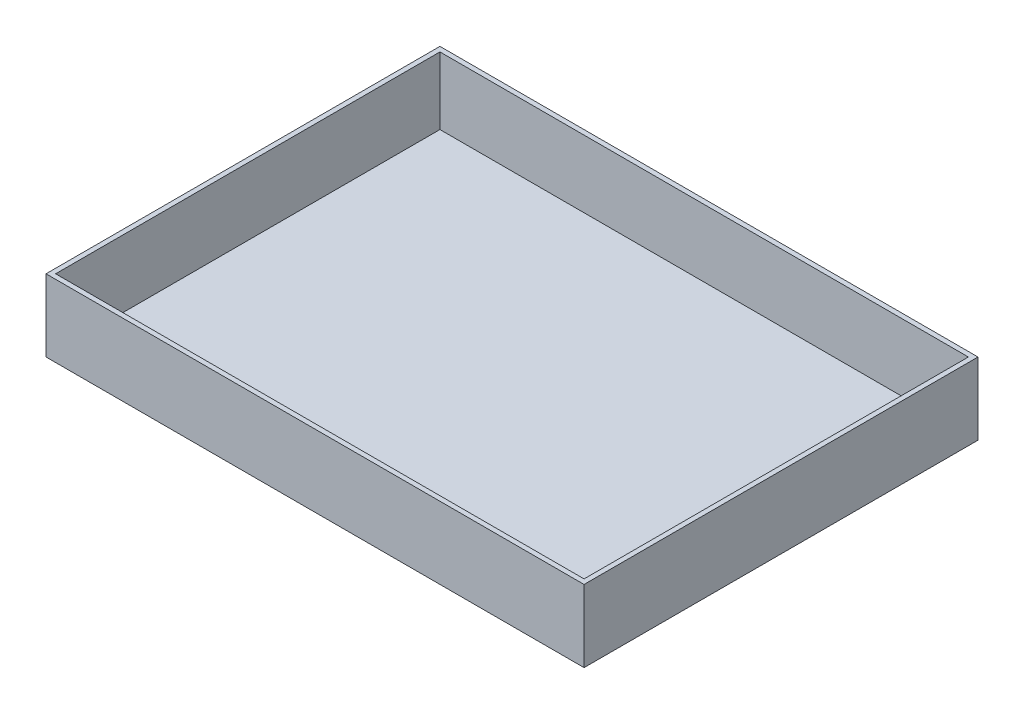
from build123d import *

# Parameters (mm, degrees)
SKETCH_1_W      = 560
SKETCH_1_H      = 410
EXTRUDE_1_DEPTH = 75
SHELL_1_T       = -5


with BuildPart() as part:
    # ｽｹｯﾁ1 → ﾎﾞｽ - 押し出し1 (new body)
    with BuildSketch(Plane(origin=(0, 0, 0), x_dir=(1, 0, 0), z_dir=(0, 1, 0))):
        Rectangle(SKETCH_1_W, SKETCH_1_H)
    extrude(amount=EXTRUDE_1_DEPTH)

    # ｼｪﾙ1
    shell_1_openings = [part.faces().sort_by_distance(p)[0] for p in [
        (0, 75, 0),
    ]]
    offset(amount=SHELL_1_T, openings=shell_1_openings, kind=Kind.INTERSECTION)


solid = part.part
